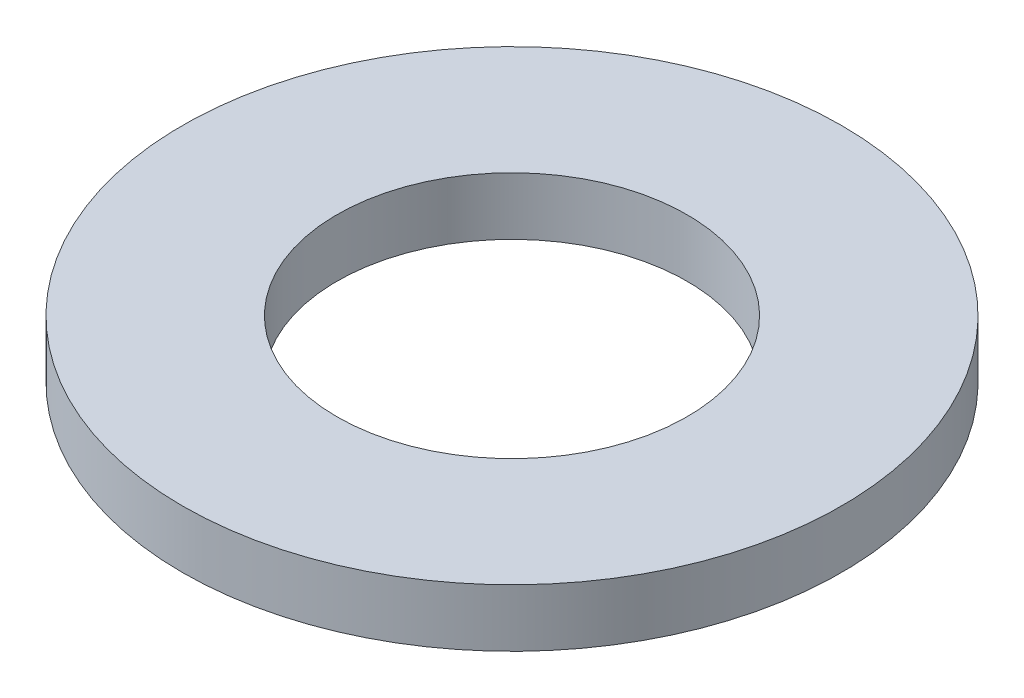
from build123d import *

# Parameters (mm, degrees)
SKETCH1_R           = 80
BOSS_EXTRUDE1_DEPTH = 14
SKETCH2_R           = 42.5
CUT_EXTRUDE1_DEPTH  = 115


with BuildPart() as part:
    # Sketch1 → Boss-Extrude1 (new body)
    with BuildSketch(Plane(origin=(0, 0, 0), x_dir=(1, 0, 0), z_dir=(0, 1, 0))):
        Circle(SKETCH1_R)
    extrude(amount=BOSS_EXTRUDE1_DEPTH)

    # Sketch2 → Cut-Extrude1 (cut, through all)
    with BuildSketch(Plane(origin=(0, 0, 0), x_dir=(1, 0, 0), z_dir=(0, 1, 0))):
        Circle(SKETCH2_R)
    extrude(amount=CUT_EXTRUDE1_DEPTH, mode=Mode.SUBTRACT)


solid = part.part
